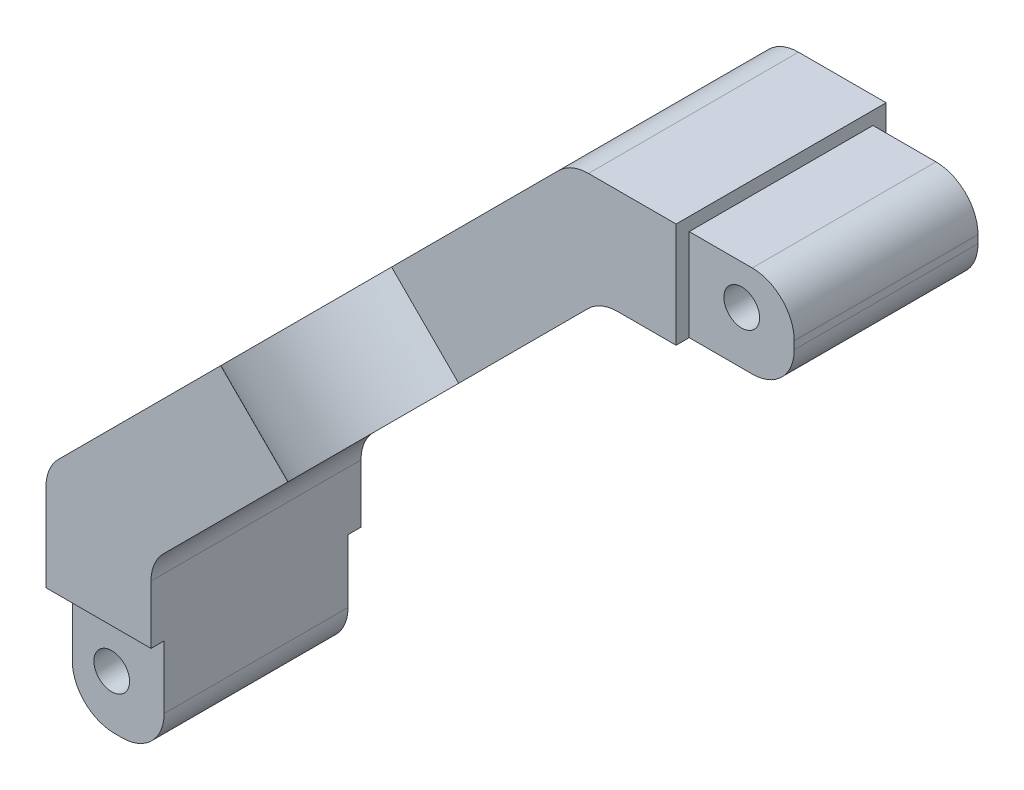
from build123d import *

# Parameters (mm, degrees)
BOSS_EXTRUDE1_DEPTH    = 25.4
SKETCH2_R              = 2.159
SKETCH2_W              = 12.7
SKETCH2_H              = 1.5875
SKETCH2_W_2            = 1.5875
SKETCH2_H_2            = 12.7
CUT_EXTRUDE1_DEPTH     = 25.4
SKETCH3_W              = 12.7
SKETCH3_H              = 1.5875
SKETCH3_H_2            = 1.5748
CUT_EXTRUDE2_DEPTH     = 12.7
SKETCH4_W              = 1.5875
SKETCH4_H              = 12.7
CUT_EXTRUDE3_DEPTH     = 12.7
F_3DSKETCH1_R          = 19.05
F_3DSKETCH1_R_2        = 11.1125
BOSS_EXTRUDE2_DEPTH    = 11.482870812
CUT_EXTRUDE4_START     = 44.901280605
CUT_EXTRUDE4_OUTLINE_R = 11.1125
CUT_EXTRUDE4_DEPTH     = 11.482870812
SKETCH5_R              = 11.1125
SKETCH5_R_2            = 4.572
BOSS_EXTRUDE3_DEPTH    = 3.81
FILLET1_R              = 5.08
FILLET2_R              = 1.016


# Read off the part's stored shape, not the designer's step: Cut-Extrude4
with BuildPart() as part:
    # Sketch1 → Boss-Extrude1 (new body)
    with BuildSketch(Plane.XY):
        Polygon((88.9, 0), (63.5, 0), (0, -63.5), (0, -88.9), (12.7, -88.9), (12.7, -67.039231637), (67.039231637, -12.7), (88.9, -12.7), align=None)
    extrude(amount=BOSS_EXTRUDE1_DEPTH)

    # Sketch2 → Cut-Extrude1 (cut)
    with BuildSketch(Plane.XY.offset(25.4)):
        with Locations((82.55, -6.3627)):
            Circle(SKETCH2_R)
        with Locations((6.3627, -82.55)):
            Circle(SKETCH2_R)
        with Locations((82.55, -0.79375)):
            Rectangle(SKETCH2_W, SKETCH2_H)
        with Locations((0.79375, -82.55)):
            Rectangle(SKETCH2_W_2, SKETCH2_H_2)
    extrude(amount=-CUT_EXTRUDE1_DEPTH, mode=Mode.SUBTRACT)

    # Sketch3 → Cut-Extrude2 (cut)
    with BuildSketch(Plane.XZ.offset(88.9)):
        with Locations((6.35, 24.60625)):
            Rectangle(SKETCH3_W, SKETCH3_H)
        with Locations((6.35, 0.7874)):
            Rectangle(SKETCH3_W, SKETCH3_H_2)
    extrude(amount=-CUT_EXTRUDE2_DEPTH, mode=Mode.SUBTRACT)

    # Sketch4 → Cut-Extrude3 (cut)
    with BuildSketch(Plane(origin=(88.9, 0, 0), x_dir=(0, 0, -1), z_dir=(1, 0, 0))):
        with Locations((-0.79375, -6.35)):
            Rectangle(SKETCH4_W, SKETCH4_H)
        with Locations((-24.60625, -6.35)):
            Rectangle(SKETCH4_W, SKETCH4_H)
    extrude(amount=-CUT_EXTRUDE3_DEPTH, mode=Mode.SUBTRACT)

    # 3DSketch1 → Boss-Extrude2 (add)
    with BuildSketch(Plane(origin=(67.039231637, -12.7, 0), x_dir=(-0.6713837490692134, -0.6713837490692195, 0.3138275369873187), z_dir=(0.7071067811865508, -0.7071067811865444, 0))):
        with Locations((40.468086778, 0)):
            Circle(F_3DSKETCH1_R)
        with Locations((40.468086778, 0)):
            Circle(F_3DSKETCH1_R_2, mode=Mode.SUBTRACT)
    extrude(amount=-BOSS_EXTRUDE2_DEPTH)

    # Cut-Extrude4 outline → Cut-Extrude4 (cut)
    with BuildSketch(Plane(origin=(0, 0, 0), x_dir=(0.7071067811865438, 0.7071067811865512, 0), z_dir=(0.7071067811865511, -0.7071067811865441, 0)).offset(CUT_EXTRUDE4_START)):
        with Locations((0, 12.7)):
            Circle(CUT_EXTRUDE4_OUTLINE_R)
    extrude(amount=CUT_EXTRUDE4_DEPTH, mode=Mode.SUBTRACT)

    # Sketch5 → Boss-Extrude3 (add)
    with BuildSketch(Plane(origin=(31.75, -31.75, 0), x_dir=(0, 0, 1), z_dir=(-0.7071067811865476, 0.7071067811865475, 0))):
        with Locations(Location((12.7, 0, 0), (0, 0, 270))):
            Circle(SKETCH5_R)
        with Locations(Location((12.7, 0, 0), (0, 0, 270))):
            Circle(SKETCH5_R_2, mode=Mode.SUBTRACT)
    extrude(amount=-BOSS_EXTRUDE3_DEPTH)

    # Fillet1
    fillet1_edges = [part.edges().sort_by_distance(p)[0] for p in [
        (88.9, -1.5875, 12.7),
        (88.9, -12.7, 12.7),
        (63.5, 0, 12.7),
        (67.039231637, -12.7, 12.7),
        (12.7, -67.039231637, 12.7),
        (0, -63.5, 12.7),
        (1.5875, -88.9, 12.69365),
        (12.7, -88.9, 12.69365),
    ]]
    fillet(fillet1_edges, radius=FILLET1_R)

    # Fillet2
    fillet2_edges = [part.edges().sort_by_distance(p)[0] for p in [
        (32.011891712, -47.727339924, 12.7),
    ]]
    fillet(fillet2_edges, radius=FILLET2_R)


solid = part.part
